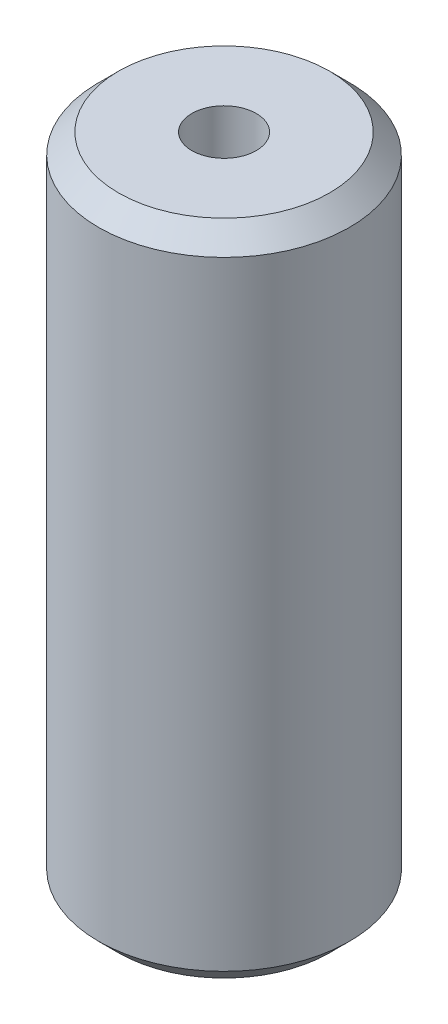
from build123d import *

# Parameters (mm, degrees)
SKETCH1_R           = 5
BOSS_EXTRUDE1_DEPTH = 26.235097726
SKETCH2_R           = 1.284158119
CUT_EXTRUDE1_DEPTH  = 28.171314887
CHAMFER1_SIZE       = 0.793679497


with BuildPart() as part:
    # Sketch1 → Boss-Extrude1 (new body)
    with BuildSketch(Plane(origin=(0, 0, 0), x_dir=(1, 0, 0), z_dir=(0, 1, 0))):
        Circle(SKETCH1_R)
    extrude(amount=BOSS_EXTRUDE1_DEPTH)

    # Sketch2 → Cut-Extrude1 (cut, through all)
    with BuildSketch(Plane(origin=(0, 0, 0), x_dir=(1, 0, 0), z_dir=(0, 1, 0))):
        Circle(SKETCH2_R)
    extrude(amount=CUT_EXTRUDE1_DEPTH, mode=Mode.SUBTRACT)

    # Chamfer1
    chamfer1_edges = [part.edges().sort_by_distance(p)[0] for p in [
        (-5, 26.235097726, 0),
        (-5, 0, 0),
    ]]
    chamfer(chamfer1_edges, length=CHAMFER1_SIZE)


solid = part.part
